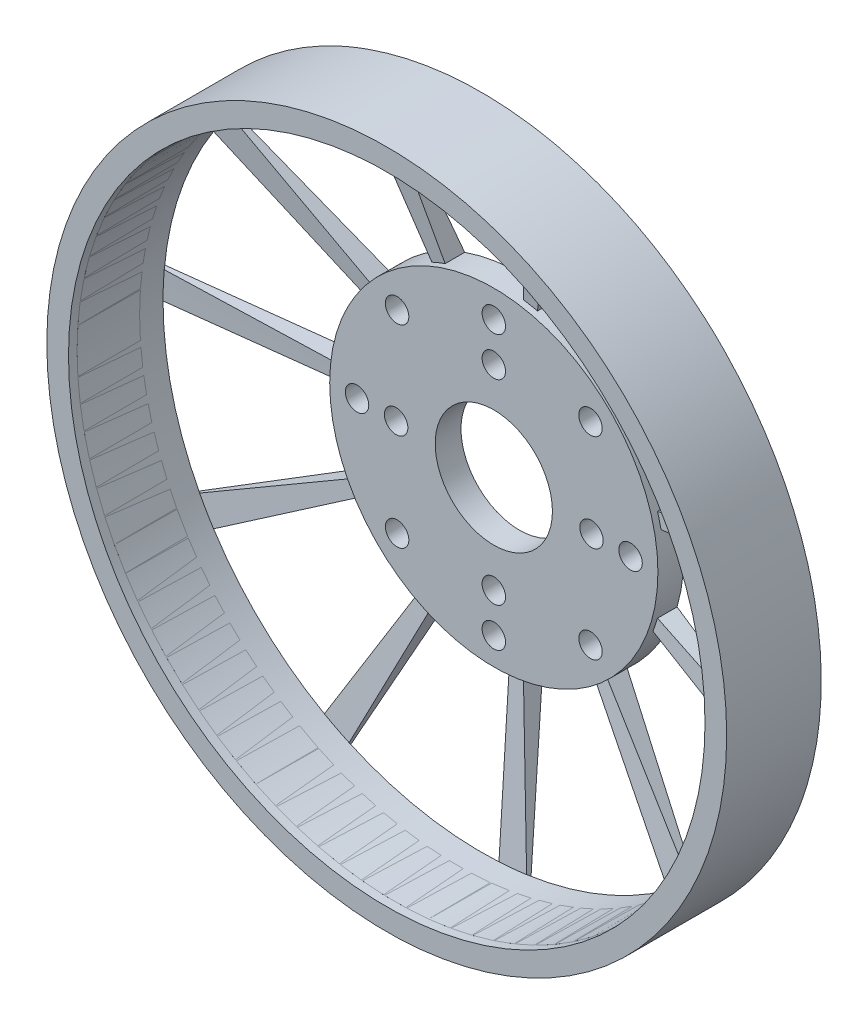
from build123d import *

# Parameters (mm, degrees)
BOSS_EXTRUDE1_START = 4.9
SKETCH1_R           = 43.5
SKETCH1_R_2         = 40.725
BOSS_EXTRUDE1_DEPTH = 12.1
SKETCH1_4_R         = 21
SKETCH1_4_R_2       = 7.5
BOSS_EXTRUDE2_DEPTH = 3.3
REVOLVE1_ANGLE      = 5
CIRPATTERN1_COUNT   = 11
SKETCH6_R           = 1.5
CUT_EXTRUDE1_DEPTH  = 5
BOSS_EXTRUDE5_START = -1.1
SKETCH7_R           = 43.25
SKETCH7_R_2         = 40.725
BOSS_EXTRUDE5_DEPTH = 8


with BuildPart() as part:
    # Sketch1 → Boss-Extrude1 (new body)
    with BuildSketch(Plane.XY.offset(BOSS_EXTRUDE1_START)):
        Circle(SKETCH1_R)
        Circle(SKETCH1_R_2, mode=Mode.SUBTRACT)
    extrude(amount=BOSS_EXTRUDE1_DEPTH)



with BuildPart() as body_2:
    # Sketch1<4> → Boss-Extrude2 (new body)
    with BuildSketch(Plane.XY):
        Circle(SKETCH1_4_R)
        Circle(SKETCH1_4_R_2, mode=Mode.SUBTRACT)
    extrude(amount=BOSS_EXTRUDE2_DEPTH)


with BuildPart() as part_1:
    add(part.part)

    add(body_2.part)  # Revolve1 merges body 2
    # Sketch2 → Revolve1 (revolve)
    with BuildSketch(Plane(origin=(0, 0, 0), x_dir=(1, 0, 0), z_dir=(0, 1, 0))):
        Polygon((-43.5, -4.9), (-40.725, -4.9), (-21, -2.5), (-21, 0), align=None)
    revolve1 = revolve(axis=Axis((0, 0, 3.3), (0, 0, -1)), revolution_arc=REVOLVE1_ANGLE)

    # CirPattern1: Revolve1 ×11 about axis
    cirpattern1_axis = Axis((0, 0, 3.3), (0, 0, -1))
    for i in range(1, CIRPATTERN1_COUNT):
        add(revolve1.rotate(cirpattern1_axis, i * 360 / CIRPATTERN1_COUNT))

    # Sketch6 → Cut-Extrude1 (cut)
    with BuildSketch(Plane(origin=(0, 0, 0), x_dir=(-1, 0, 0), z_dir=(0, 0, -1))):
        with Locations((0, 12.5)):
            Circle(SKETCH6_R)
        with Locations((12.5, 0)):
            Circle(SKETCH6_R)
        with Locations((0, -12.5)):
            Circle(SKETCH6_R)
        with Locations((-12.5, 0)):
            Circle(SKETCH6_R)
        with Locations((0, 17.5)):
            Circle(SKETCH6_R)
        with Locations((12.374368671, 12.374368671)):
            Circle(SKETCH6_R)
        with Locations((17.5, 0)):
            Circle(SKETCH6_R)
        with Locations((12.374368671, -12.374368671)):
            Circle(SKETCH6_R)
        with Locations((0, -17.5)):
            Circle(SKETCH6_R)
        with Locations((-12.374368671, -12.374368671)):
            Circle(SKETCH6_R)
        with Locations((-17.5, 0)):
            Circle(SKETCH6_R)
        with Locations((-12.374368671, 12.374368671)):
            Circle(SKETCH6_R)
    extrude(amount=-CUT_EXTRUDE1_DEPTH, mode=Mode.SUBTRACT)


with BuildPart() as body_2_2:
    # Sketch7 → Boss-Extrude5 (new body)
    with BuildSketch(Plane.XY.offset(17).offset(BOSS_EXTRUDE5_START)):
        Circle(SKETCH7_R)
        Circle(SKETCH7_R_2, mode=Mode.SUBTRACT)
    extrude(amount=-BOSS_EXTRUDE5_DEPTH)


solid = Compound([part_1.part, body_2_2.part])
